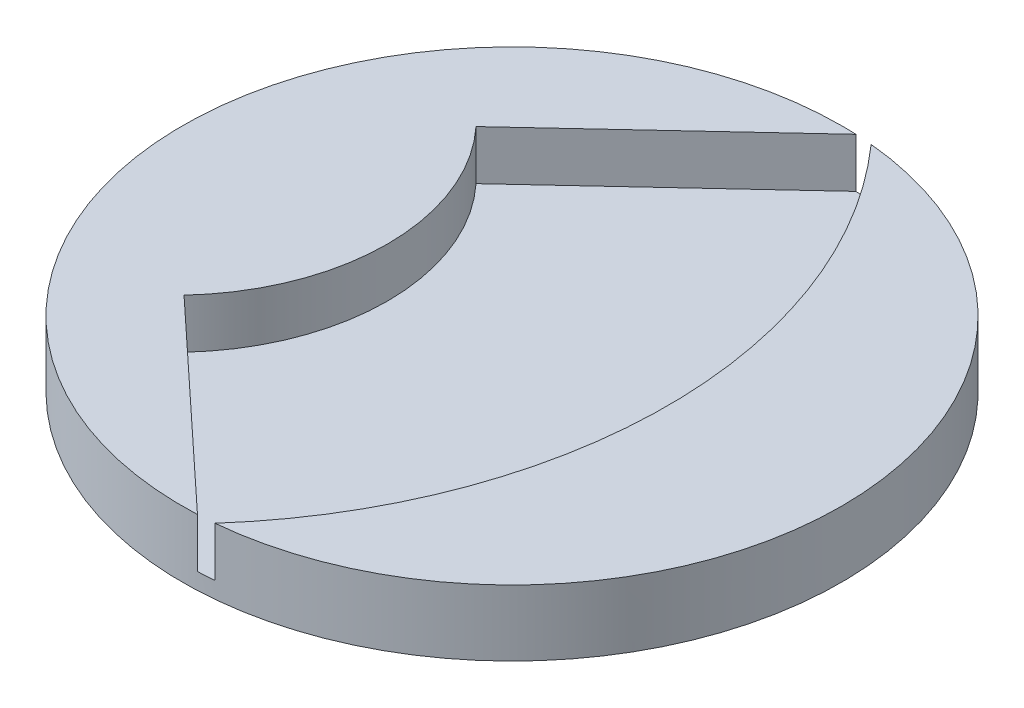
from build123d import *

# Parameters (mm, degrees)
CUT_EXTRUDE1_DEPTH = 3


with BuildPart() as part:
    # Sketch1 → Revolve1 (revolve)
    with BuildSketch(Plane.XY):
        Polygon((1.15, -2), (1.15, 2), (0, 2), (0, 6), (20, 6), (20, 2), (3.15, 2), (3.15, -2), align=None)
    revolve(axis=Axis((0, -3.539189189, 0), (0, 1, 0)))

    # Sketch2 → Cut-Extrude1 (cut)
    with BuildSketch(Plane(origin=(0, 6, 0), x_dir=(1, 0, 0), z_dir=(0, 1, 0))):
        with BuildLine():
            Line((1.392300157, 20.449162801), (-11.046410614, 8.86130388))
            ThreePointArc((-11.046410614, 8.86130388), (-7.55836591, 0), (-11.046410614, -8.86130388))
            Line((-11.046410614, -8.86130388), (1.392300157, -20.449162801))
            ThreePointArc((1.392300157, -20.449162801), (9.44163409, 0), (1.392300157, 20.449162801))
        make_face()
    extrude(amount=-CUT_EXTRUDE1_DEPTH, mode=Mode.SUBTRACT)


solid = part.part
